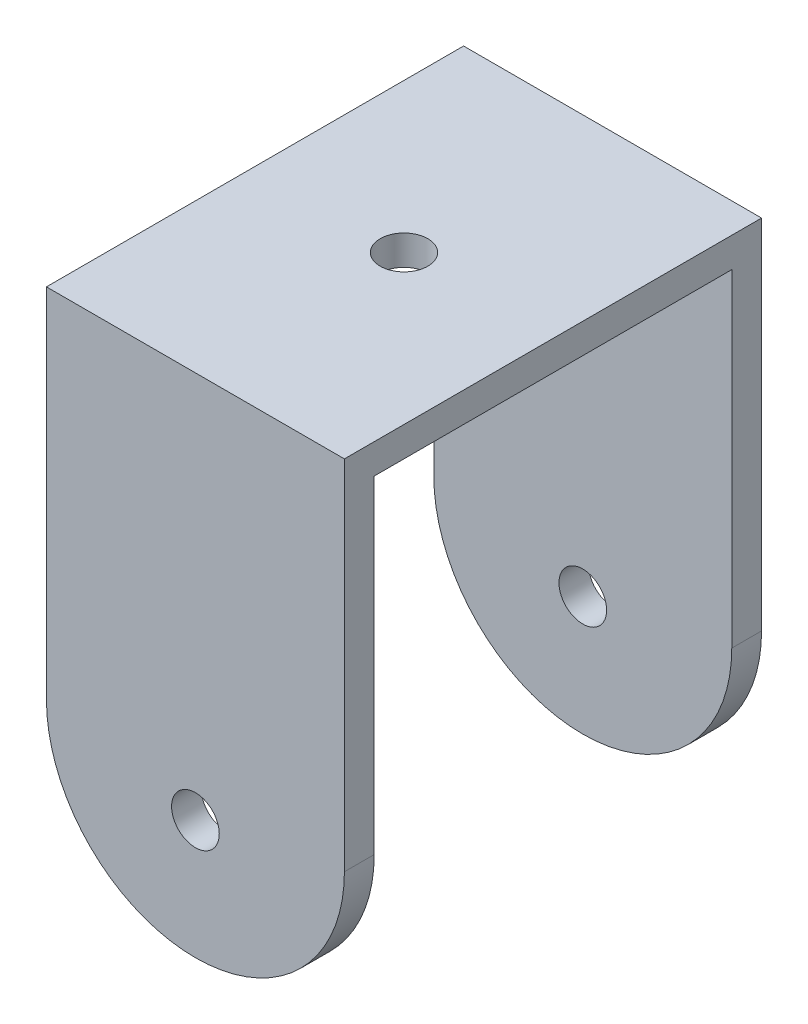
from build123d import *

# Parameters (mm, degrees)
SKETCH_1_W          = 50
SKETCH_1_H          = 80
EXTRUDE_1_DEPTH     = 5
SKETCH_2_W          = 50
SKETCH_2_H          = 80
EXTRUDE_2_DEPTH     = 5
SKETCH_3_W          = 50
SKETCH_3_H          = 70
EXTRUDE_3_DEPTH     = 5
SKETCH_4_R          = 4
CUT_EXTRUDE_1_DEPTH = 87.890735985
SKETCH_5_R          = 4
CUT_EXTRUDE_2_DEPTH = 113.915897906
FILLET_1_R          = 25


with BuildPart() as part:
    # 草图1 → 凸台-拉伸1 (new body)
    with BuildSketch(Plane.XY):
        Rectangle(SKETCH_1_W, SKETCH_1_H)
    extrude(amount=EXTRUDE_1_DEPTH)



with BuildPart() as body_2:
    # 草图2 → 凸台-拉伸2 (new body)
    with BuildSketch(Plane.XY.offset(65)):
        Rectangle(SKETCH_2_W, SKETCH_2_H)
    extrude(amount=EXTRUDE_2_DEPTH)


with BuildPart() as part_1:
    add(part.part)

    add(body_2.part)  # 凸台-拉伸3 merges body 2
    # 草图3 → 凸台-拉伸3 (add)
    with BuildSketch(Plane(origin=(0, 40, 0), x_dir=(1, 0, 0), z_dir=(0, 1, 0))):
        with Locations((0, -35)):
            Rectangle(SKETCH_3_W, SKETCH_3_H)
    extrude(amount=EXTRUDE_3_DEPTH)

    # 草图4 → 切除-拉伸1 (cut, through all)
    with BuildSketch(Plane.XY.offset(70)):
        with Locations((0, -20)):
            Circle(SKETCH_4_R)
    extrude(amount=-CUT_EXTRUDE_1_DEPTH, mode=Mode.SUBTRACT)

    # 草图5 → 切除-拉伸2 (cut, through all)
    with BuildSketch(Plane(origin=(0, 45, 0), x_dir=(1, 0, 0), z_dir=(0, 1, 0))):
        with Locations(Location((0, -35, 0), (0, 0, 180))):
            Circle(SKETCH_5_R)
    extrude(amount=-CUT_EXTRUDE_2_DEPTH, mode=Mode.SUBTRACT)

    # 圆角1
    fillet_1_edges = [part_1.edges().sort_by_distance(p)[0] for p in [
        (-25, -40, 2.5),
        (25, -40, 2.5),
        (25, -40, 67.5),
        (-25, -40, 67.5),
    ]]
    fillet(fillet_1_edges, radius=FILLET_1_R - 0.0001)  # a hair under: the kernel refuses the full size


solid = part_1.part
